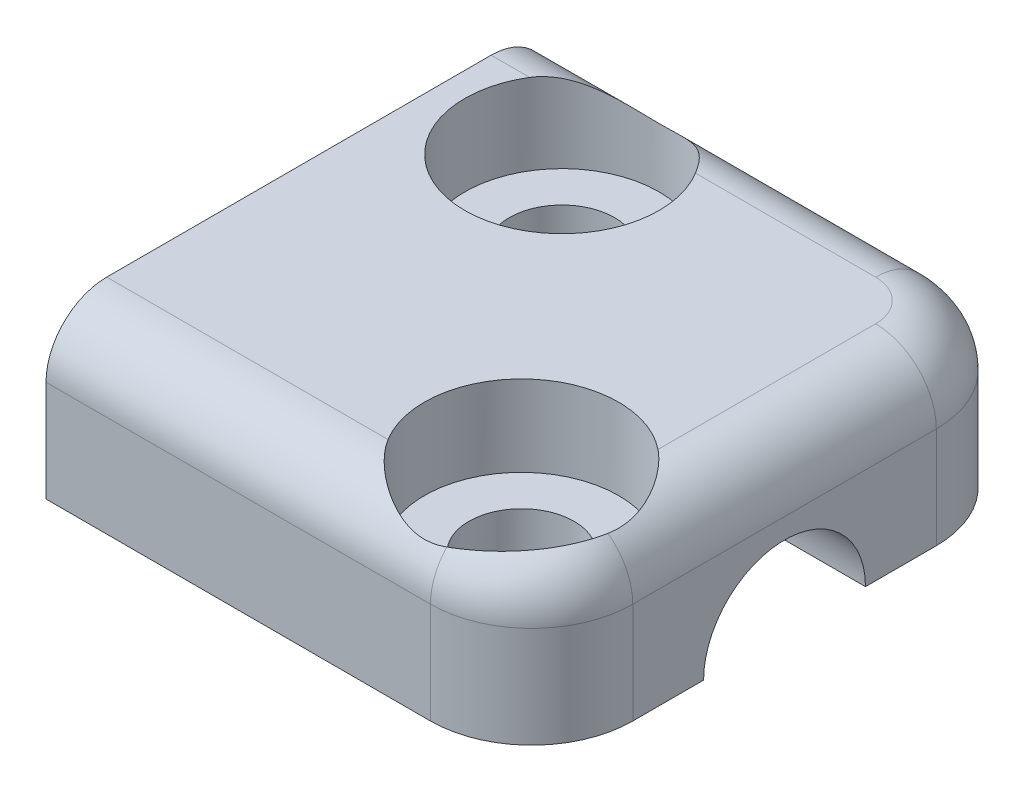
from build123d import *

# Parameters (mm, degrees)
SKETCH1_W           = 24
SKETCH1_H           = 25
BOSS_EXTRUDE1_DEPTH = 8
SKETCH2_R           = 4
CUT_EXTRUDE1_DEPTH  = 29.217902119
SKETCH3_R           = 2.6
CUT_EXTRUDE2_DEPTH  = 20.085334684
FILLET1_R           = 3
FILLET2_R           = 5
SKETCH4_R           = 4.8
CUT_EXTRUDE3_DEPTH  = 4


with BuildPart() as part:
    # Sketch1 → Boss-Extrude1 (new body)
    with BuildSketch(Plane(origin=(0, 0, 0), x_dir=(1, 0, 0), z_dir=(0, 1, 0))):
        Rectangle(SKETCH1_W, SKETCH1_H)
    extrude(amount=BOSS_EXTRUDE1_DEPTH)

    # Sketch2 → Cut-Extrude1 (cut, through all)
    with BuildSketch(Plane.ZY.offset(12)):
        Circle(SKETCH2_R)
    extrude(amount=-CUT_EXTRUDE1_DEPTH, mode=Mode.SUBTRACT)

    # Sketch3 → Cut-Extrude2 (cut, through all)
    with BuildSketch(Plane.XZ):
        with Locations(Location((-6, -7, 0), (0, 0, 270))):
            Circle(SKETCH3_R)
        with Locations(Location((6, 7, 0), (0, 0, 270))):
            Circle(SKETCH3_R)
    extrude(amount=-CUT_EXTRUDE2_DEPTH, mode=Mode.SUBTRACT)

    # Fillet1
    # the kernel refuses this fillet: 3 mm, written as the material it takes off along each edge
    with BuildSketch(Plane(origin=(19.5, 8, 12.5), x_dir=(0, 0, -1), z_dir=(-1, 0, 0))) as fillet1_piece_1:
        with BuildLine():
            CenterArc((FILLET1_R, FILLET1_R), FILLET1_R, 180, 90)
            Line((0, FILLET1_R), (0, 0))
            Line((0, 0), (FILLET1_R, 0))
        make_face()
    extrude(amount=39, mode=Mode.SUBTRACT)
    with BuildSketch(Plane(origin=(12, 8, -20), x_dir=(0, -1, 0), z_dir=(0, 0, 1))) as fillet1_piece_2:
        with BuildLine():
            CenterArc((FILLET1_R, -FILLET1_R), FILLET1_R, 90, 90)
            Line((0, -FILLET1_R), (0, 0))
            Line((0, 0), (FILLET1_R, 0))
        make_face()
    extrude(amount=40, mode=Mode.SUBTRACT)
    with BuildSketch(Plane(origin=(-19.5, 8, -12.5), x_dir=(0, -1, 0), z_dir=(1, 0, 0))) as fillet1_piece_3:
        with BuildLine():
            CenterArc((FILLET1_R, -FILLET1_R), FILLET1_R, 90, 90)
            Line((0, -FILLET1_R), (0, 0))
            Line((0, 0), (FILLET1_R, 0))
        make_face()
    extrude(amount=39, mode=Mode.SUBTRACT)

    # Fillet2
    # the kernel refuses this fillet: 5 mm, written as the material it takes off along each edge
    with BuildSketch(Plane(origin=(7, 8, 7.5), x_dir=(0, 0, 1), z_dir=(-1, 0, 0))) as fillet2_piece_1:
        with BuildLine():
            CenterArc((2, -3), 3, 0, 90)
            Line((5, -3), (5, 0))
            Line((5, 0), (2, 0))
        make_face()
    revolve(axis=Axis((7, 8, 7.5), (0, 1, 0)), revolution_arc=90, mode=Mode.SUBTRACT)
    with BuildSketch(Plane(origin=(7, 8, -7.5), x_dir=(1, 0, 0), z_dir=(0, 0, 1))) as fillet2_piece_2:
        with BuildLine():
            CenterArc((2, -3), 3, 0, 90)
            Line((5, -3), (5, 0))
            Line((5, 0), (2, 0))
        make_face()
    revolve(axis=Axis((7, 8, -7.5), (0, 1, 0)), revolution_arc=90, mode=Mode.SUBTRACT)
    with BuildSketch(Plane(origin=(12, -12.5, -12.5), x_dir=(-1, 0, 0), z_dir=(0, 1, 0)), Plane(origin=(12, -12.5, 12.5), x_dir=(0, 0, -1), z_dir=(0, 1, 0))) as fillet2_piece_3:
        with BuildLine():
            CenterArc((FILLET2_R, FILLET2_R), FILLET2_R, 180, 90)
            Line((0, FILLET2_R), (0, 0))
            Line((0, 0), (FILLET2_R, 0))
        make_face()
    extrude(amount=20.5, mode=Mode.SUBTRACT)

    # Sketch4 → Cut-Extrude3 (cut)
    with BuildSketch(Plane(origin=(0, 8, 0), x_dir=(1, 0, 0), z_dir=(0, 1, 0))):
        with Locations(Location((-6, 7, 0), (0, 0, 270))):
            Circle(SKETCH4_R)
        with Locations(Location((6, -7, 0), (0, 0, 270))):
            Circle(SKETCH4_R)
    extrude(amount=-CUT_EXTRUDE3_DEPTH, mode=Mode.SUBTRACT)


solid = part.part
